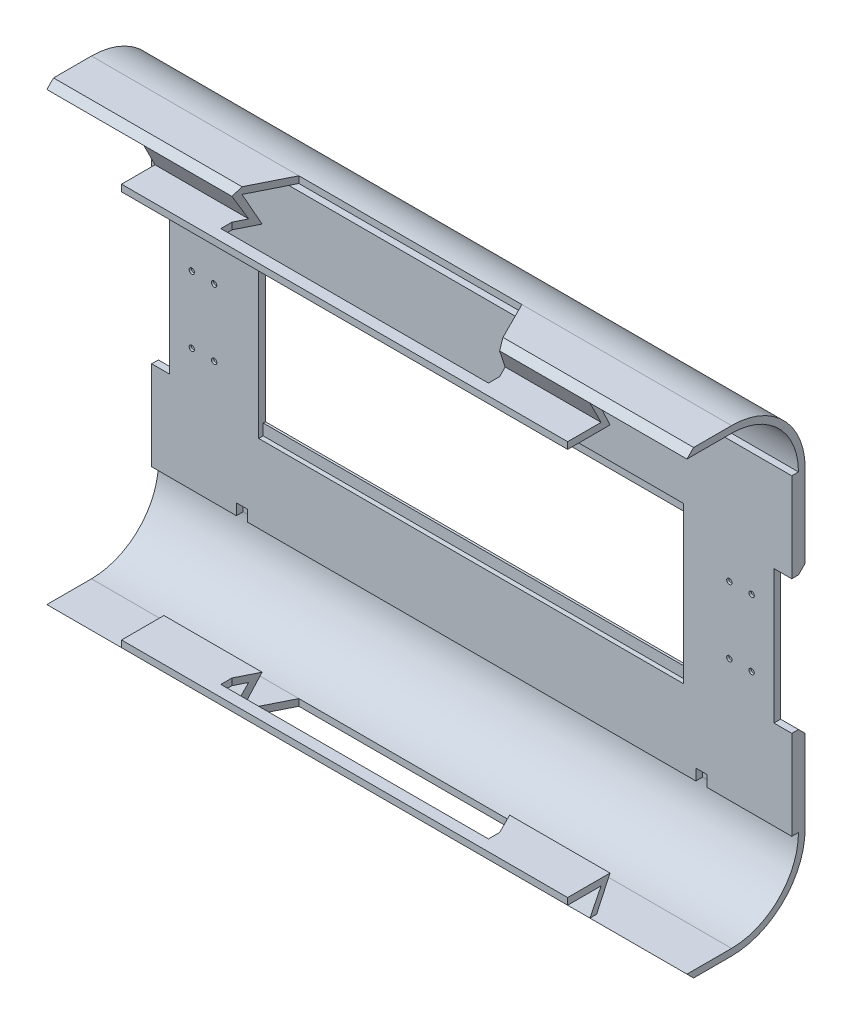
from build123d import *

# Parameters (mm, degrees)
EXTRUDE_1_DEPTH          = 3
EXTRUDE_2_DEPTH          = 287
SKETCH_4_W               = 21.736589458
SKETCH_4_H               = 200
CUT_EXTRUDE_1_DEPTH      = 43.5
SKETCH_5_W               = 23.415155123
SKETCH_5_H               = 200
CUT_EXTRUDE_2_DEPTH      = 43.5
CUT_EXTRUDE_3_DEPTH      = 259.263552403
HOLE_WIZARD_1_AT_2_COUNT = 2
HOLE_WIZARD_1_AT_2_PITCH = 31.622776602
HOLE_WIZARD_1_AT_3_COUNT = 2
HOLE_WIZARD_1_AT_3_PITCH = 10
HOLE_WIZARD_1_AT_4_COUNT = 2
HOLE_WIZARD_1_AT_4_PITCH = 242.860042
HOLE_WIZARD_1_AT_5_COUNT = 2
HOLE_WIZARD_1_AT_5_PITCH = 241
HOLE_WIZARD_1_AT_6_COUNT = 2
HOLE_WIZARD_1_AT_6_PITCH = 232.939906414
HOLE_WIZARD_1_AT_7_COUNT = 2
HOLE_WIZARD_1_AT_7_PITCH = 231
HOLE_WIZARD_1_AT_8_COUNT = 2
HOLE_WIZARD_1_AT_8_PITCH = 30
SKETCH_10_W              = 190.5
SKETCH_10_H              = 70
CUT_EXTRUDE_4_DEPTH      = 2
SKETCH_11_W              = 190.5
SKETCH_11_H              = 60
CUT_EXTRUDE_5_DEPTH      = 1


with BuildPart() as part:
    # 草图1 → 凸台-拉伸1 (new body)
    with BuildSketch(Plane.XY):
        Polygon((-143.25, 30), (-143.25, 70), (-105.25, 70), (-105.25, 65), (-100.25, 65), (-100.25, 70), (100.75, 70), (100.75, 65), (105.75, 65), (105.75, 70), (143.75, 70), (143.75, 30), (135.75, 30), (135.75, -30), (143.75, -30), (143.75, -70), (105.75, -70), (105.75, -65), (100.75, -65), (100.75, -70), (-100.25, -70), (-100.25, -65), (-105.25, -65), (-105.25, -70), (-143.25, -70), (-143.25, -30), (-135.25, -30), (-135.25, 30), align=None)
    extrude(amount=EXTRUDE_1_DEPTH)

    # 草图2 → 凸台-拉伸2 (add)
    with BuildSketch(Plane.ZY.offset(143.25)):
        with BuildLine():
            Line((0, 70), (0, 30))
            Line((0, 30), (-3, 33))
            Line((-3, 33), (-3, 70))
            ThreePointArc((-3, 70), (6.665476221, 93.334523779), (30, 103))
            Line((30, 103), (47, 103))
            Line((47, 103), (50, 100))
            Line((50, 100), (45, 90))
            Line((45, 90), (60, 90))
            Line((60, 90), (60, 87))
            Line((60, 87), (41, 87))
            Line((41, 87), (47, 100))
            Line((47, 100), (30, 100))
            ThreePointArc((30, 100), (8.786796564, 91.213203436), (0, 70))
        make_face()
        with BuildLine():
            Line((30, -100), (47, -100))
            Line((47, -100), (41, -87))
            Line((41, -87), (60, -87))
            Line((60, -87), (60, -90))
            Line((60, -90), (45, -90))
            Line((45, -90), (50, -100))
            Line((50, -100), (47, -103))
            Line((47, -103), (30, -103))
            ThreePointArc((30, -103), (6.665476221, -93.334523779), (-3, -70))
            Line((-3, -70), (-3, -33))
            Line((-3, -33), (0, -30))
            Line((0, -30), (0, -70))
            ThreePointArc((0, -70), (8.786796564, -91.213203436), (30, -100))
        make_face()
    extrude(amount=-EXTRUDE_2_DEPTH)

    # 草图4 → 切除-拉伸1 (cut)
    with BuildSketch(Plane.ZY.offset(143.25)):
        with Locations((49.368294729, 0)):
            Rectangle(SKETCH_4_W, SKETCH_4_H)
    extrude(amount=-CUT_EXTRUDE_1_DEPTH, mode=Mode.SUBTRACT)

    # 草图5 → 切除-拉伸2 (cut)
    with BuildSketch(Plane(origin=(143.75, 0, 0), x_dir=(0, 0, -1), z_dir=(1, 0, 0))):
        with Locations((-51.459603014, 0)):
            Rectangle(SKETCH_5_W, SKETCH_5_H)
    extrude(amount=-CUT_EXTRUDE_2_DEPTH, mode=Mode.SUBTRACT)

    # 草图6 → 切除-拉伸3 (cut, through all)
    with BuildSketch(Plane(origin=(0, 103, 0), x_dir=(1, 0, 0), z_dir=(0, 1, 0))):
        Polygon((0.25, -30), (-50.25, -30), (-60.25, -50), (-60.25, -55), (59.75, -55), (59.75, -50), (49.75, -30), align=None)
    extrude(amount=-CUT_EXTRUDE_3_DEPTH, mode=Mode.SUBTRACT)

    # 草图9 → 大小六角凹头盖螺钉柱孔1 (revolve, cut)
    with BuildSketch(Plane(origin=(115.75, 15, 0), x_dir=(0, 1, 0), z_dir=(1, 0, 0))):
        Polygon((0, 0), (0, 60), (1.2, 60), (1.2, 2), (2.15, 2), (2.15, 0.024142219), (2.175, 0), align=None)
    hole_wizard_1 = revolve(axis=Axis((115.75, 15, -6.35), (0, 0, 1)), mode=Mode.SUBTRACT)

    # 大小六角凹头盖螺钉柱孔1 at 2: 大小六角凹头盖螺钉柱孔1 ×2
    with Locations(*[Vector(0.3162277660168351, -0.9486832980505148, 0) * (i * HOLE_WIZARD_1_AT_2_PITCH) for i in range(1, HOLE_WIZARD_1_AT_2_COUNT)]):
        add(hole_wizard_1, mode=Mode.SUBTRACT)

    # 大小六角凹头盖螺钉柱孔1 at 3: 大小六角凹头盖螺钉柱孔1 ×2
    with Locations(*[(i * HOLE_WIZARD_1_AT_3_PITCH, 0, 0) for i in range(1, HOLE_WIZARD_1_AT_3_COUNT)]):
        add(hole_wizard_1, mode=Mode.SUBTRACT)

    # 大小六角凹头盖螺钉柱孔1 at 4: 大小六角凹头盖螺钉柱孔1 ×2
    with Locations(*[Vector(-0.9923410949607508, -0.12352793713204367, 0) * (i * HOLE_WIZARD_1_AT_4_PITCH) for i in range(1, HOLE_WIZARD_1_AT_4_COUNT)]):
        add(hole_wizard_1, mode=Mode.SUBTRACT)

    # 大小六角凹头盖螺钉柱孔1 at 5: 大小六角凹头盖螺钉柱孔1 ×2
    with Locations(*[(-i * HOLE_WIZARD_1_AT_5_PITCH, 0, 0) for i in range(1, HOLE_WIZARD_1_AT_5_COUNT)]):
        add(hole_wizard_1, mode=Mode.SUBTRACT)

    # 大小六角凹头盖螺钉柱孔1 at 6: 大小六角凹头盖螺钉柱孔1 ×2
    with Locations(*[Vector(-0.9916720735252418, -0.12878858097730414, 0) * (i * HOLE_WIZARD_1_AT_6_PITCH) for i in range(1, HOLE_WIZARD_1_AT_6_COUNT)]):
        add(hole_wizard_1, mode=Mode.SUBTRACT)

    # 大小六角凹头盖螺钉柱孔1 at 7: 大小六角凹头盖螺钉柱孔1 ×2
    with Locations(*[(-i * HOLE_WIZARD_1_AT_7_PITCH, 0, 0) for i in range(1, HOLE_WIZARD_1_AT_7_COUNT)]):
        add(hole_wizard_1, mode=Mode.SUBTRACT)

    # 大小六角凹头盖螺钉柱孔1 at 8: 大小六角凹头盖螺钉柱孔1 ×2
    with Locations(*[(0, -i * HOLE_WIZARD_1_AT_8_PITCH, 0) for i in range(1, HOLE_WIZARD_1_AT_8_COUNT)]):
        add(hole_wizard_1, mode=Mode.SUBTRACT)

    # 草图10 → 切除-拉伸4 (cut)
    with BuildSketch(Plane.XY.offset(3)):
        Rectangle(SKETCH_10_W, SKETCH_10_H)
    extrude(amount=-CUT_EXTRUDE_4_DEPTH, mode=Mode.SUBTRACT)

    # 草图11 → 切除-拉伸5 (cut)
    with BuildSketch(Plane.XY):
        Rectangle(SKETCH_11_W, SKETCH_11_H)
    extrude(amount=CUT_EXTRUDE_5_DEPTH, mode=Mode.SUBTRACT)


solid = part.part
